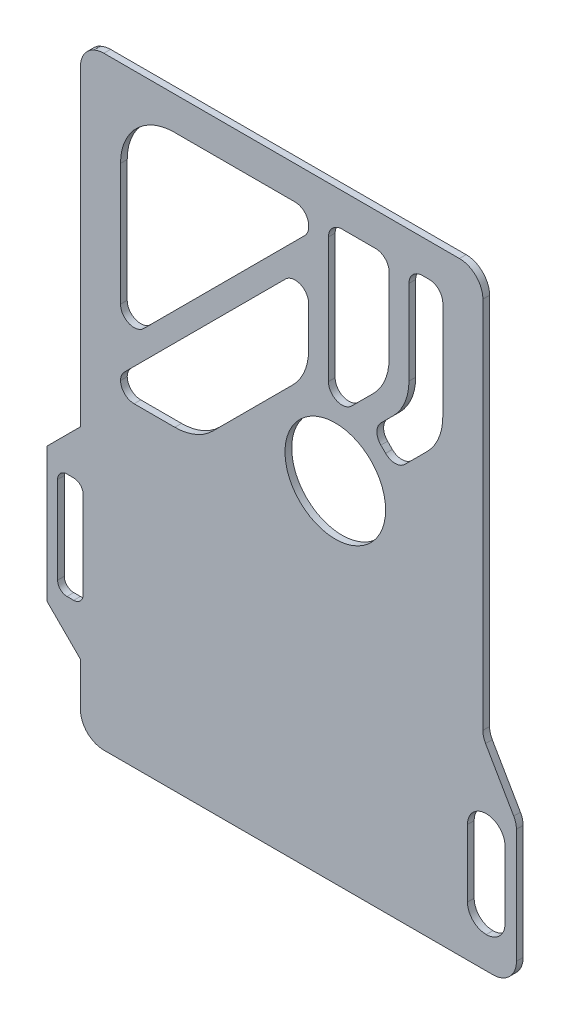
from build123d import *

# Parameters (mm, degrees)
SKETCH_1_R          = 7.5
EXTRUDE_1_DEPTH     = 1
FILLET_1_R          = 3
FILLET_2_R          = 3.5
CUT_EXTRUDE_1_DEPTH = 10


with BuildPart() as part:
    # 草图1 → 凸台-拉伸1 (new body)
    with BuildSketch(Plane.XY):
        with BuildLine():
            ThreePointArc((-32.5, 37.977350269), (-33.269043009, 37.891244277), (-34, 37.637190605))
            Line((-34, 37.637190605), (-34, 37.66227766))
            ThreePointArc((-34, 37.66227766), (-35.458039892, 36.370828693), (-36, 34.5))
            Line((-36, 34.5), (-36, -12))
            Line((-36, -12), (-41, -17))
            Line((-41, -17), (-41, -37))
            Line((-41, -37), (-36, -42))
            Line((-36, -42), (-36, -48.5))
            ThreePointArc((-36, -48.5), (-34.974873734, -50.974873734), (-32.5, -52))
            Line((-32.5, -52), (-3, -52))
            Line((-3, -52), (29, -52))
            Line((29, -52), (29, -30.660254038))
            Line((29, -30.660254038), (24, -22))
            Line((24, -22), (24, -2))
            Line((24, -2), (24, 37.977350269))
            Line((24, 37.977350269), (-32.5, 37.977350269))
        make_face()
        with BuildLine():
            Line((-37, -34.9), (-38, -34.9))
            ThreePointArc((-38, -34.9), (-38.989949494, -34.489949494), (-39.4, -33.5))
            Line((-39.4, -33.5), (-39.4, -20.5))
            ThreePointArc((-39.4, -20.5), (-38.989949494, -19.510050506), (-38, -19.1))
            Line((-38, -19.1), (-37, -19.1))
            ThreePointArc((-37, -19.1), (-36.010050506, -19.510050506), (-35.6, -20.5))
            Line((-35.6, -20.5), (-35.6, -33.5))
            ThreePointArc((-35.6, -33.5), (-36.010050506, -34.489949494), (-37, -34.9))
        make_face(mode=Mode.SUBTRACT)
        with BuildLine():
            Line((-29.430229341, -1.640838471), (-5.430229341, 22.359161529))
            ThreePointArc((-5.430229341, 22.359161529), (-3.225965459, 22.797616876), (-1.977350269, 20.928932188))
            Line((-1.977350269, 20.928932188), (-1.977350269, 14.928932188))
            ThreePointArc((-1.977350269, 14.928932188), (-2.588038117, 11.858797052), (-4.327129972, 9.25606216))
            Line((-4.327129972, 9.25606216), (-16.25606216, -2.672870028))
            ThreePointArc((-16.25606216, -2.672870028), (-18.858797052, -4.411961883), (-21.928932188, -5.022649731))
            Line((-21.928932188, -5.022649731), (-28, -5.022649731))
            ThreePointArc((-28, -5.022649731), (-29.41761054, -4.442737776), (-30.022337577, -3.035533906))
            ThreePointArc((-30.022337577, -3.035533906), (-29.861813207, -2.280647977), (-29.430229341, -1.640838471))
        make_face(mode=Mode.SUBTRACT)
        with BuildLine():
            Line((-2.569770659, 29.398197784), (-26.569770659, 5.398197784))
            ThreePointArc((-26.569770659, 5.398197784), (-28.774034541, 4.959742437), (-30.022649731, 6.828427125))
            Line((-30.022649731, 6.828427125), (-30.022649731, 25))
            ThreePointArc((-30.022649731, 25), (-27.672870028, 30.672870028), (-22, 33.022649731))
            Line((-22, 33.022649731), (-4, 33.022649731))
            ThreePointArc((-4, 33.022649731), (-2.569770659, 32.430229341), (-1.977350269, 31))
            Line((-1.977350269, 31), (-1.977350269, 30.828427125))
            ThreePointArc((-1.977350269, 30.828427125), (-2.131315312, 30.054392583), (-2.569770659, 29.398197784))
        make_face(mode=Mode.SUBTRACT)
        with Locations((2, 0)):
            Circle(SKETCH_1_R, mode=Mode.SUBTRACT)
        with BuildLine():
            Line((3, 33.022649731), (8, 33.022649731))
            ThreePointArc((8, 33.022649731), (9.430229341, 32.430229341), (10.022649731, 31))
            Line((10.022649731, 31), (10.022649731, 19.813708499))
            ThreePointArc((10.022649731, 19.813708499), (9.411961883, 16.743573363), (7.672870028, 14.140838471))
            Line((7.672870028, 14.140838471), (4.430229341, 10.898197784))
            ThreePointArc((4.430229341, 10.898197784), (2.225965459, 10.459742437), (0.977350269, 12.328427125))
            Line((0.977350269, 12.328427125), (0.977350269, 31))
            ThreePointArc((0.977350269, 31), (1.569770659, 32.430229341), (3, 33.022649731))
        make_face(mode=Mode.SUBTRACT)
        with BuildLine():
            Line((12.977350269, 18.384776311), (12.977350269, 31))
            ThreePointArc((12.977350269, 31), (13.569770659, 32.430229341), (15, 33.022649731))
            Line((15, 33.022649731), (16, 33.022649731))
            ThreePointArc((16, 33.022649731), (17.430229341, 32.430229341), (18.022649731, 31))
            Line((18.022649731, 31), (18.022649731, 16.313708499))
            ThreePointArc((18.022649731, 16.313708499), (17.411961883, 13.243573363), (15.672870028, 10.640838471))
            Line((15.672870028, 10.640838471), (12.359161529, 7.327129972))
            ThreePointArc((12.359161529, 7.327129972), (10.928932188, 6.734709582), (9.498702848, 7.327129972))
            Line((9.498702848, 7.327129972), (8.791596066, 8.034236753))
            ThreePointArc((8.791596066, 8.034236753), (8.199175676, 9.464466094), (8.791596066, 10.894695435))
            Line((8.791596066, 10.894695435), (10.640838471, 12.74393784))
            ThreePointArc((10.640838471, 12.74393784), (12.370110637, 15.331976529), (12.977350269, 18.384776311))
        make_face(mode=Mode.SUBTRACT)
    extrude(amount=EXTRUDE_1_DEPTH)

    # 圆角1
    fillet_1_edges = [part.edges().sort_by_distance(p)[0] for p in [
        (29, -30.660254038, 0.5),
        (24, -22, 0.5),
    ]]
    fillet(fillet_1_edges, radius=FILLET_1_R)

    # 圆角2
    fillet_2_edges = [part.edges().sort_by_distance(p)[0] for p in [
        (29, -52, 0.5),
        (24, 37.977350269, 0.5),
    ]]
    fillet(fillet_2_edges, radius=FILLET_2_R)

    # 草图2 → 切除-拉伸1 (cut)
    with BuildSketch(Plane(origin=(0, 0, 0), x_dir=(-1, 0, 0), z_dir=(0, 0, -1))):
        with BuildLine():
            Line((-27.3, -44.51), (-27.3, -34.49))
            ThreePointArc((-27.3, -34.49), (-26.48282792, -32.51717208), (-24.51, -31.7))
            Line((-24.51, -31.7), (-24.49, -31.7))
            ThreePointArc((-24.49, -31.7), (-22.51717208, -32.51717208), (-21.7, -34.49))
            Line((-21.7, -34.49), (-21.7, -44.51))
            ThreePointArc((-21.7, -44.51), (-22.51717208, -46.48282792), (-24.49, -47.3))
            Line((-24.49, -47.3), (-24.51, -47.3))
            ThreePointArc((-24.51, -47.3), (-26.48282792, -46.48282792), (-27.3, -44.51))
        make_face()
    extrude(amount=-CUT_EXTRUDE_1_DEPTH, mode=Mode.SUBTRACT)


solid = part.part
